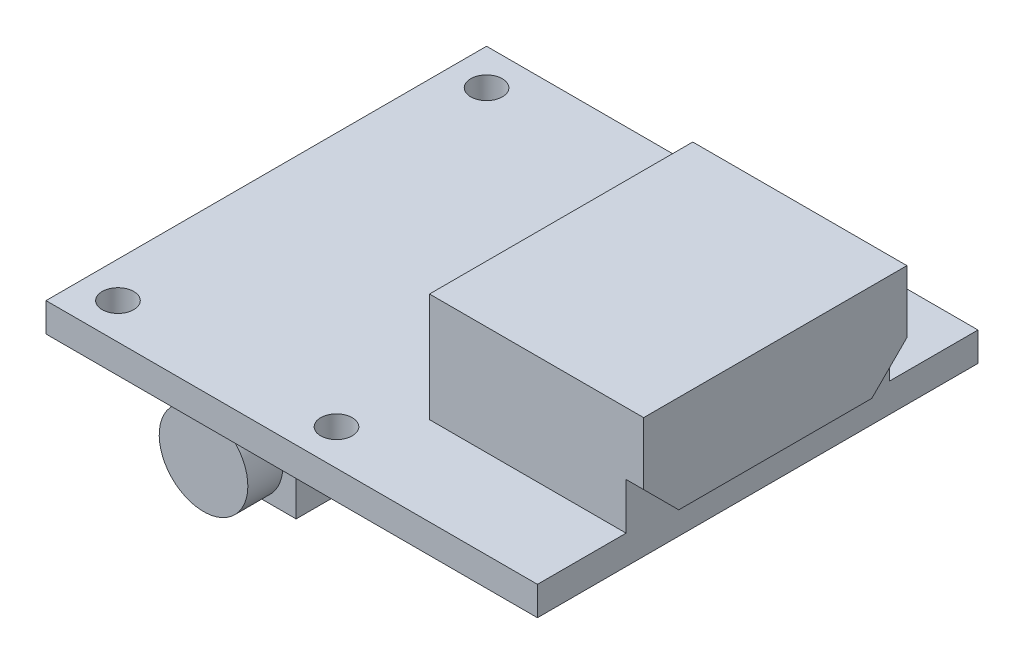
from build123d import *

# Parameters (mm, degrees)
SKETCH1_W           = 28
SKETCH1_H           = 25.1
BOSS_EXTRUDE1_DEPTH = 1.65
SKETCH2_W           = 11.2
SKETCH2_H           = 15
BOSS_EXTRUDE2_DEPTH = 6.2
BOSS_EXTRUDE3_DEPTH = 1
SKETCH4_W           = 6.55
SKETCH4_H           = 11.95
BOSS_EXTRUDE4_DEPTH = 4.5
SKETCH5_R           = 2.525
BOSS_EXTRUDE5_DEPTH = 2
SKETCH6_R           = 0.9
CUT_EXTRUDE1_DEPTH  = 22.074273416


with BuildPart() as part:
    # Sketch1 → Boss-Extrude1 (new body)
    with BuildSketch(Plane(origin=(0, 0, 0), x_dir=(1, 0, 0), z_dir=(0, 1, 0))):
        Rectangle(SKETCH1_W, SKETCH1_H)
    extrude(amount=BOSS_EXTRUDE1_DEPTH)

    # Sketch2 → Boss-Extrude2 (add)
    with BuildSketch(Plane(origin=(0, 1.65, 0), x_dir=(1, 0, 0), z_dir=(0, 1, 0))):
        with Locations((8.4, 0)):
            Rectangle(SKETCH2_W, SKETCH2_H)
    extrude(amount=BOSS_EXTRUDE2_DEPTH)

    # Sketch3 → Boss-Extrude3 (add)
    with BuildSketch(Plane(origin=(14, 0, 0), x_dir=(0, 0, -1), z_dir=(1, 0, 0))):
        Polygon((-7.5, 4.3), (-7.5, 7.85), (7.5, 7.85), (7.5, 4.3), (5.5, 2.3), (-5.5, 2.3), align=None)
    extrude(amount=BOSS_EXTRUDE3_DEPTH)

    # Sketch4 → Boss-Extrude4 (add)
    with BuildSketch(Plane.XZ):
        with Locations((-5.525, 4.075)):
            Rectangle(SKETCH4_W, SKETCH4_H)
    extrude(amount=BOSS_EXTRUDE4_DEPTH)

    # Sketch5 → Boss-Extrude5 (add)
    with BuildSketch(Plane.XY.offset(10.05)):
        with Locations((-5.525, -2.25)):
            Circle(SKETCH5_R)
    extrude(amount=BOSS_EXTRUDE5_DEPTH)

    # Sketch6 → Cut-Extrude1 (cut, through all)
    with BuildSketch(Plane(origin=(0, 0, 0), x_dir=(-1, 0, 0), z_dir=(0, -1, 0))):
        with Locations((11.95, -10.5)):
            Circle(SKETCH6_R)
        with Locations((11.95, 10.5)):
            Circle(SKETCH6_R)
        with Locations((-0.5, 10.5)):
            Circle(SKETCH6_R)
        with Locations((-0.5, -10.5)):
            Circle(SKETCH6_R)
    extrude(amount=-CUT_EXTRUDE1_DEPTH, mode=Mode.SUBTRACT)


solid = part.part
